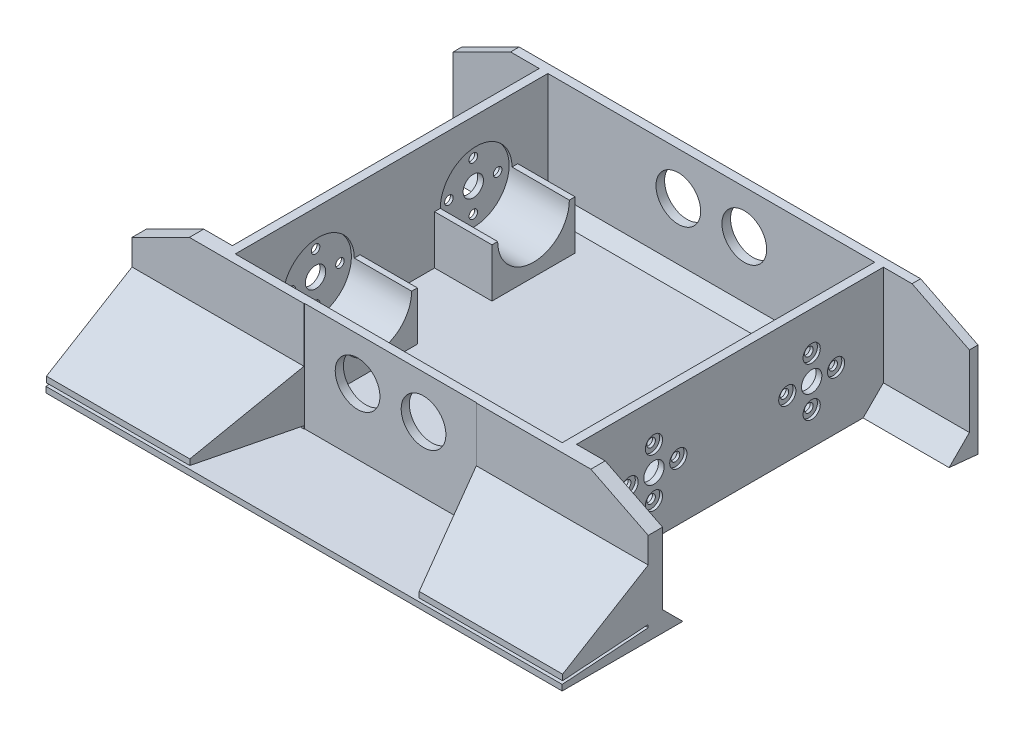
from build123d import *

# Parameters (mm, degrees)
SKETCH1_W                       = 180
SKETCH1_H                       = 145
BOSS_EXTRUDE1_DEPTH             = 2
BOSS_EXTRUDE2_DEPTH             = 180
SKETCH6_W                       = 180
SKETCH6_H                       = 115
BOSS_EXTRUDE3_DEPTH             = 40
SKETCH8_W                       = 30
SKETCH8_H                       = 110
CUT_EXTRUDE3_DEPTH              = 42
SHELL1_START                    = -69.5
SHELL1_OUTLINE_W                = 114
SHELL1_OUTLINE_H                = 39
SHELL1_DEPTH                    = 109
BOSS_EXTRUDE5_DEPTH             = 20
CUT_EXTRUDE11_REACH             = 171.202
SKETCH20_R                      = 3.55
SKETCH20_R_2                    = 1.5
CUT_EXTRUDE11_DIRECTION_2_REACH = 171.202
SKETCH21_R                      = 3
CUT_EXTRUDE12_DEPTH             = 1
CUT_EXTRUDE13_START             = -1
SKETCH22_R                      = 3
CUT_EXTRUDE13_DEPTH             = 1
CUT_EXTRUDE14_DEPTH             = 58
CUT_EXTRUDE14_DEPTH_BACK        = 58
SKETCH23_R                      = 12.5
BOSS_EXTRUDE7_DEPTH             = 180
CUT_EXTRUDE18_REACH             = 124.964
BOSS_EXTRUDE8_REACH             = 173.815
BOSS_EXTRUDE8_DIRECTION_2_REACH = 173.815
CUT_EXTRUDE19_REACH             = 153.951
CUT_EXTRUDE10_REACH             = 124.964
SKETCH16_R                      = 7.8
CUT_EXTRUDE10_DIRECTION_2_REACH = 124.964
BOSS_EXTRUDE9_REACH             = 200.545
CUT_EXTRUDE1_REACH              = 123.039
SKETCH4_R                       = 1.5
CUT_EXTRUDE1_DIRECTION_2_DEPTH  = 5


# Read off the part's stored shape, not the designer's step: Shell1
with BuildPart() as part:
    # Sketch1 → Boss-Extrude1 (new body)
    with BuildSketch(Plane(origin=(0, 0, 0), x_dir=(1, 0, 0), z_dir=(0, 1, 0))):
        Rectangle(SKETCH1_W, SKETCH1_H)
    extrude(amount=BOSS_EXTRUDE1_DEPTH)

    # Sketch3 → Boss-Extrude2 (add)
    with BuildSketch(Plane.ZY.offset(90)):
        Polygon((72.5, 0), (42.5, 0), (42.5, 4.097804358), (72.5, 2), align=None)
    extrude(amount=-BOSS_EXTRUDE2_DEPTH)

    # Sketch6 → Boss-Extrude3 (add)
    with BuildSketch(Plane(origin=(0, 2, 0), x_dir=(1, 0, 0), z_dir=(0, 1, 0))):
        with Locations((0, 15)):
            Rectangle(SKETCH6_W, SKETCH6_H)
    extrude(amount=BOSS_EXTRUDE3_DEPTH)

    # Sketch8 → Cut-Extrude3 (cut)
    with BuildSketch(Plane(origin=(0, 42, 0), x_dir=(1, 0, 0), z_dir=(0, 1, 0))):
        with Locations((-75, 17.5)):
            Rectangle(SKETCH8_W, SKETCH8_H)
        with Locations((75, 17.5)):
            Rectangle(SKETCH8_W, SKETCH8_H)
    extrude(amount=-CUT_EXTRUDE3_DEPTH, mode=Mode.SUBTRACT)

    # Shell1 outline → Shell1 (cut)
    with BuildSketch(Plane.XY.offset(SHELL1_START)):
        with Locations((0, 22.5)):
            Rectangle(SHELL1_OUTLINE_W, SHELL1_OUTLINE_H)
    extrude(amount=SHELL1_DEPTH, mode=Mode.SUBTRACT)

    # Sketch11 → Boss-Extrude5 (add)
    with BuildSketch(Plane(origin=(-57, 0, 0), x_dir=(0, 0, -1), z_dir=(1, 0, 0))):
        with BuildLine():
            Line((57, 20), (59, 20))
            Line((59, 20), (59, 0))
            Line((59, 0), (30, 0))
            Line((30, 0), (30, 20))
            Line((30, 20), (32, 20))
            ThreePointArc((32, 20), (44.5, 7.5), (57, 20))
        make_face()
        with BuildLine():
            Line((2, 20), (4, 20))
            Line((4, 20), (4, 0))
            Line((4, 0), (-25, 0))
            Line((-25, 0), (-25, 20))
            Line((-25, 20), (-23, 20))
            ThreePointArc((-23, 20), (-10.5, 7.5), (2, 20))
        make_face()
    boss_extrude5 = extrude(amount=BOSS_EXTRUDE5_DEPTH)

    # Mirror1: Boss-Extrude5 across plane
    add(boss_extrude5.mirror(Plane(origin=(0, 0, 0), x_dir=(0, 0, 1), z_dir=(1, 0, 0))))

    # Cut-Extrude11: up to this face of the body (flat: up to its plane)
    cut_extrude11_end = Plane(part.part.faces().sort_by_distance((60, 21, -17.5))[0])
    # Sketch20 → Cut-Extrude11 (cut, up to the picked face)
    with BuildSketch(Plane(origin=(-57, 0, 0), x_dir=(0, 0, -1), z_dir=(1, 0, 0)), mode=Mode.PRIVATE) as cut_extrude11_sk1:
        with Locations(Location((-10.5, 20, 0), (0, 0, 180))):
            Circle(SKETCH20_R)
    cut_extrude11_tool1 = split(extrude(cut_extrude11_sk1.sketch, amount=CUT_EXTRUDE11_REACH, mode=Mode.PRIVATE), bisect_by=cut_extrude11_end, keep=Keep.BOTH, mode=Mode.PRIVATE)
    # Sketch20 → Cut-Extrude11 (cut, up to the picked face)
    with BuildSketch(Plane(origin=(-57, 0, 0), x_dir=(0, 0, -1), z_dir=(1, 0, 0)), mode=Mode.PRIVATE) as cut_extrude11_sk2:
        with Locations(Location((44.5, 20, 0), (0, 0, 180))):
            Circle(SKETCH20_R)
    cut_extrude11_tool2 = split(extrude(cut_extrude11_sk2.sketch, amount=CUT_EXTRUDE11_REACH, mode=Mode.PRIVATE), bisect_by=cut_extrude11_end, keep=Keep.BOTH, mode=Mode.PRIVATE)
    # Sketch20 → Cut-Extrude11 (cut, up to the picked face)
    with BuildSketch(Plane(origin=(-57, 0, 0), x_dir=(0, 0, -1), z_dir=(1, 0, 0)), mode=Mode.PRIVATE) as cut_extrude11_sk3:
        with Locations(Location((-2, 20, 0), (0, 0, 180))):
            Circle(SKETCH20_R_2)
    cut_extrude11_tool3 = split(extrude(cut_extrude11_sk3.sketch, amount=CUT_EXTRUDE11_REACH, mode=Mode.PRIVATE), bisect_by=cut_extrude11_end, keep=Keep.BOTH, mode=Mode.PRIVATE)
    # Sketch20 → Cut-Extrude11 (cut, up to the picked face)
    with BuildSketch(Plane(origin=(-57, 0, 0), x_dir=(0, 0, -1), z_dir=(1, 0, 0)), mode=Mode.PRIVATE) as cut_extrude11_sk4:
        with Locations(Location((-19, 20, 0), (0, 0, 180))):
            Circle(SKETCH20_R_2)
    cut_extrude11_tool4 = split(extrude(cut_extrude11_sk4.sketch, amount=CUT_EXTRUDE11_REACH, mode=Mode.PRIVATE), bisect_by=cut_extrude11_end, keep=Keep.BOTH, mode=Mode.PRIVATE)
    # Sketch20 → Cut-Extrude11 (cut, up to the picked face)
    with BuildSketch(Plane(origin=(-57, 0, 0), x_dir=(0, 0, -1), z_dir=(1, 0, 0)), mode=Mode.PRIVATE) as cut_extrude11_sk5:
        with Locations(Location((-10.5, 28.5, 0), (0, 0, 180))):
            Circle(SKETCH20_R_2)
    cut_extrude11_tool5 = split(extrude(cut_extrude11_sk5.sketch, amount=CUT_EXTRUDE11_REACH, mode=Mode.PRIVATE), bisect_by=cut_extrude11_end, keep=Keep.BOTH, mode=Mode.PRIVATE)
    # Sketch20 → Cut-Extrude11 (cut, up to the picked face)
    with BuildSketch(Plane(origin=(-57, 0, 0), x_dir=(0, 0, -1), z_dir=(1, 0, 0)), mode=Mode.PRIVATE) as cut_extrude11_sk6:
        with Locations(Location((-10.5, 11.5, 0), (0, 0, 180))):
            Circle(SKETCH20_R_2)
    cut_extrude11_tool6 = split(extrude(cut_extrude11_sk6.sketch, amount=CUT_EXTRUDE11_REACH, mode=Mode.PRIVATE), bisect_by=cut_extrude11_end, keep=Keep.BOTH, mode=Mode.PRIVATE)
    # Sketch20 → Cut-Extrude11 (cut, up to the picked face)
    with BuildSketch(Plane(origin=(-57, 0, 0), x_dir=(0, 0, -1), z_dir=(1, 0, 0)), mode=Mode.PRIVATE) as cut_extrude11_sk7:
        with Locations(Location((36, 20, 0), (0, 0, 180))):
            Circle(SKETCH20_R_2)
    cut_extrude11_tool7 = split(extrude(cut_extrude11_sk7.sketch, amount=CUT_EXTRUDE11_REACH, mode=Mode.PRIVATE), bisect_by=cut_extrude11_end, keep=Keep.BOTH, mode=Mode.PRIVATE)
    # Sketch20 → Cut-Extrude11 (cut, up to the picked face)
    with BuildSketch(Plane(origin=(-57, 0, 0), x_dir=(0, 0, -1), z_dir=(1, 0, 0)), mode=Mode.PRIVATE) as cut_extrude11_sk8:
        with Locations(Location((53, 20, 0), (0, 0, 180))):
            Circle(SKETCH20_R_2)
    cut_extrude11_tool8 = split(extrude(cut_extrude11_sk8.sketch, amount=CUT_EXTRUDE11_REACH, mode=Mode.PRIVATE), bisect_by=cut_extrude11_end, keep=Keep.BOTH, mode=Mode.PRIVATE)
    # Sketch20 → Cut-Extrude11 (cut, up to the picked face)
    with BuildSketch(Plane(origin=(-57, 0, 0), x_dir=(0, 0, -1), z_dir=(1, 0, 0)), mode=Mode.PRIVATE) as cut_extrude11_sk9:
        with Locations(Location((44.5, 11.5, 0), (0, 0, 180))):
            Circle(SKETCH20_R_2)
    cut_extrude11_tool9 = split(extrude(cut_extrude11_sk9.sketch, amount=CUT_EXTRUDE11_REACH, mode=Mode.PRIVATE), bisect_by=cut_extrude11_end, keep=Keep.BOTH, mode=Mode.PRIVATE)
    # Sketch20 → Cut-Extrude11 (cut, up to the picked face)
    with BuildSketch(Plane(origin=(-57, 0, 0), x_dir=(0, 0, -1), z_dir=(1, 0, 0)), mode=Mode.PRIVATE) as cut_extrude11_sk10:
        with Locations(Location((44.5, 28.5, 0), (0, 0, 180))):
            Circle(SKETCH20_R_2)
    cut_extrude11_tool10 = split(extrude(cut_extrude11_sk10.sketch, amount=CUT_EXTRUDE11_REACH, mode=Mode.PRIVATE), bisect_by=cut_extrude11_end, keep=Keep.BOTH, mode=Mode.PRIVATE)
    add(cut_extrude11_tool1.solids().sort_by(Axis((-57, 20, 10.5), (1, 0, 0)))[0], mode=Mode.SUBTRACT)
    add(cut_extrude11_tool2.solids().sort_by(Axis((-57, 20, -44.5), (1, 0, 0)))[0], mode=Mode.SUBTRACT)
    add(cut_extrude11_tool3.solids().sort_by(Axis((-57, 20, 2), (1, 0, 0)))[0], mode=Mode.SUBTRACT)
    add(cut_extrude11_tool4.solids().sort_by(Axis((-57, 20, 19), (1, 0, 0)))[0], mode=Mode.SUBTRACT)
    add(cut_extrude11_tool5.solids().sort_by(Axis((-57, 28.5, 10.5), (1, 0, 0)))[0], mode=Mode.SUBTRACT)
    add(cut_extrude11_tool6.solids().sort_by(Axis((-57, 11.5, 10.5), (1, 0, 0)))[0], mode=Mode.SUBTRACT)
    add(cut_extrude11_tool7.solids().sort_by(Axis((-57, 20, -36), (1, 0, 0)))[0], mode=Mode.SUBTRACT)
    add(cut_extrude11_tool8.solids().sort_by(Axis((-57, 20, -53), (1, 0, 0)))[0], mode=Mode.SUBTRACT)
    add(cut_extrude11_tool9.solids().sort_by(Axis((-57, 11.5, -44.5), (1, 0, 0)))[0], mode=Mode.SUBTRACT)
    add(cut_extrude11_tool10.solids().sort_by(Axis((-57, 28.5, -44.5), (1, 0, 0)))[0], mode=Mode.SUBTRACT)

    # Cut-Extrude11 direction 2: up to this face of the body (flat: up to its plane)
    cut_extrude11_direction_2_end = Plane(part.part.faces().sort_by_distance((-60, 21, -17.5))[0])
    # Sketch20 → Cut-Extrude11 direction 2 (cut, up to the picked face)
    with BuildSketch(Plane(origin=(-57, 0, 0), x_dir=(0, 0, -1), z_dir=(1, 0, 0)), mode=Mode.PRIVATE) as cut_extrude11_direction_2_sk1:
        with Locations(Location((-10.5, 20, 0), (0, 0, 180))):
            Circle(SKETCH20_R)
    cut_extrude11_direction_2_tool1 = split(extrude(cut_extrude11_direction_2_sk1.sketch, amount=-CUT_EXTRUDE11_DIRECTION_2_REACH, mode=Mode.PRIVATE), bisect_by=cut_extrude11_direction_2_end, keep=Keep.BOTH, mode=Mode.PRIVATE)
    # Sketch20 → Cut-Extrude11 direction 2 (cut, up to the picked face)
    with BuildSketch(Plane(origin=(-57, 0, 0), x_dir=(0, 0, -1), z_dir=(1, 0, 0)), mode=Mode.PRIVATE) as cut_extrude11_direction_2_sk2:
        with Locations(Location((44.5, 20, 0), (0, 0, 180))):
            Circle(SKETCH20_R)
    cut_extrude11_direction_2_tool2 = split(extrude(cut_extrude11_direction_2_sk2.sketch, amount=-CUT_EXTRUDE11_DIRECTION_2_REACH, mode=Mode.PRIVATE), bisect_by=cut_extrude11_direction_2_end, keep=Keep.BOTH, mode=Mode.PRIVATE)
    # Sketch20 → Cut-Extrude11 direction 2 (cut, up to the picked face)
    with BuildSketch(Plane(origin=(-57, 0, 0), x_dir=(0, 0, -1), z_dir=(1, 0, 0)), mode=Mode.PRIVATE) as cut_extrude11_direction_2_sk3:
        with Locations(Location((-2, 20, 0), (0, 0, 180))):
            Circle(SKETCH20_R_2)
    cut_extrude11_direction_2_tool3 = split(extrude(cut_extrude11_direction_2_sk3.sketch, amount=-CUT_EXTRUDE11_DIRECTION_2_REACH, mode=Mode.PRIVATE), bisect_by=cut_extrude11_direction_2_end, keep=Keep.BOTH, mode=Mode.PRIVATE)
    # Sketch20 → Cut-Extrude11 direction 2 (cut, up to the picked face)
    with BuildSketch(Plane(origin=(-57, 0, 0), x_dir=(0, 0, -1), z_dir=(1, 0, 0)), mode=Mode.PRIVATE) as cut_extrude11_direction_2_sk4:
        with Locations(Location((-19, 20, 0), (0, 0, 180))):
            Circle(SKETCH20_R_2)
    cut_extrude11_direction_2_tool4 = split(extrude(cut_extrude11_direction_2_sk4.sketch, amount=-CUT_EXTRUDE11_DIRECTION_2_REACH, mode=Mode.PRIVATE), bisect_by=cut_extrude11_direction_2_end, keep=Keep.BOTH, mode=Mode.PRIVATE)
    # Sketch20 → Cut-Extrude11 direction 2 (cut, up to the picked face)
    with BuildSketch(Plane(origin=(-57, 0, 0), x_dir=(0, 0, -1), z_dir=(1, 0, 0)), mode=Mode.PRIVATE) as cut_extrude11_direction_2_sk5:
        with Locations(Location((-10.5, 28.5, 0), (0, 0, 180))):
            Circle(SKETCH20_R_2)
    cut_extrude11_direction_2_tool5 = split(extrude(cut_extrude11_direction_2_sk5.sketch, amount=-CUT_EXTRUDE11_DIRECTION_2_REACH, mode=Mode.PRIVATE), bisect_by=cut_extrude11_direction_2_end, keep=Keep.BOTH, mode=Mode.PRIVATE)
    # Sketch20 → Cut-Extrude11 direction 2 (cut, up to the picked face)
    with BuildSketch(Plane(origin=(-57, 0, 0), x_dir=(0, 0, -1), z_dir=(1, 0, 0)), mode=Mode.PRIVATE) as cut_extrude11_direction_2_sk6:
        with Locations(Location((-10.5, 11.5, 0), (0, 0, 180))):
            Circle(SKETCH20_R_2)
    cut_extrude11_direction_2_tool6 = split(extrude(cut_extrude11_direction_2_sk6.sketch, amount=-CUT_EXTRUDE11_DIRECTION_2_REACH, mode=Mode.PRIVATE), bisect_by=cut_extrude11_direction_2_end, keep=Keep.BOTH, mode=Mode.PRIVATE)
    # Sketch20 → Cut-Extrude11 direction 2 (cut, up to the picked face)
    with BuildSketch(Plane(origin=(-57, 0, 0), x_dir=(0, 0, -1), z_dir=(1, 0, 0)), mode=Mode.PRIVATE) as cut_extrude11_direction_2_sk7:
        with Locations(Location((36, 20, 0), (0, 0, 180))):
            Circle(SKETCH20_R_2)
    cut_extrude11_direction_2_tool7 = split(extrude(cut_extrude11_direction_2_sk7.sketch, amount=-CUT_EXTRUDE11_DIRECTION_2_REACH, mode=Mode.PRIVATE), bisect_by=cut_extrude11_direction_2_end, keep=Keep.BOTH, mode=Mode.PRIVATE)
    # Sketch20 → Cut-Extrude11 direction 2 (cut, up to the picked face)
    with BuildSketch(Plane(origin=(-57, 0, 0), x_dir=(0, 0, -1), z_dir=(1, 0, 0)), mode=Mode.PRIVATE) as cut_extrude11_direction_2_sk8:
        with Locations(Location((53, 20, 0), (0, 0, 180))):
            Circle(SKETCH20_R_2)
    cut_extrude11_direction_2_tool8 = split(extrude(cut_extrude11_direction_2_sk8.sketch, amount=-CUT_EXTRUDE11_DIRECTION_2_REACH, mode=Mode.PRIVATE), bisect_by=cut_extrude11_direction_2_end, keep=Keep.BOTH, mode=Mode.PRIVATE)
    # Sketch20 → Cut-Extrude11 direction 2 (cut, up to the picked face)
    with BuildSketch(Plane(origin=(-57, 0, 0), x_dir=(0, 0, -1), z_dir=(1, 0, 0)), mode=Mode.PRIVATE) as cut_extrude11_direction_2_sk9:
        with Locations(Location((44.5, 11.5, 0), (0, 0, 180))):
            Circle(SKETCH20_R_2)
    cut_extrude11_direction_2_tool9 = split(extrude(cut_extrude11_direction_2_sk9.sketch, amount=-CUT_EXTRUDE11_DIRECTION_2_REACH, mode=Mode.PRIVATE), bisect_by=cut_extrude11_direction_2_end, keep=Keep.BOTH, mode=Mode.PRIVATE)
    # Sketch20 → Cut-Extrude11 direction 2 (cut, up to the picked face)
    with BuildSketch(Plane(origin=(-57, 0, 0), x_dir=(0, 0, -1), z_dir=(1, 0, 0)), mode=Mode.PRIVATE) as cut_extrude11_direction_2_sk10:
        with Locations(Location((44.5, 28.5, 0), (0, 0, 180))):
            Circle(SKETCH20_R_2)
    cut_extrude11_direction_2_tool10 = split(extrude(cut_extrude11_direction_2_sk10.sketch, amount=-CUT_EXTRUDE11_DIRECTION_2_REACH, mode=Mode.PRIVATE), bisect_by=cut_extrude11_direction_2_end, keep=Keep.BOTH, mode=Mode.PRIVATE)
    add(cut_extrude11_direction_2_tool1.solids().sort_by(Axis((-57, 20, 10.5), (-1, 0, 0)))[0], mode=Mode.SUBTRACT)
    add(cut_extrude11_direction_2_tool2.solids().sort_by(Axis((-57, 20, -44.5), (-1, 0, 0)))[0], mode=Mode.SUBTRACT)
    add(cut_extrude11_direction_2_tool3.solids().sort_by(Axis((-57, 20, 2), (-1, 0, 0)))[0], mode=Mode.SUBTRACT)
    add(cut_extrude11_direction_2_tool4.solids().sort_by(Axis((-57, 20, 19), (-1, 0, 0)))[0], mode=Mode.SUBTRACT)
    add(cut_extrude11_direction_2_tool5.solids().sort_by(Axis((-57, 28.5, 10.5), (-1, 0, 0)))[0], mode=Mode.SUBTRACT)
    add(cut_extrude11_direction_2_tool6.solids().sort_by(Axis((-57, 11.5, 10.5), (-1, 0, 0)))[0], mode=Mode.SUBTRACT)
    add(cut_extrude11_direction_2_tool7.solids().sort_by(Axis((-57, 20, -36), (-1, 0, 0)))[0], mode=Mode.SUBTRACT)
    add(cut_extrude11_direction_2_tool8.solids().sort_by(Axis((-57, 20, -53), (-1, 0, 0)))[0], mode=Mode.SUBTRACT)
    add(cut_extrude11_direction_2_tool9.solids().sort_by(Axis((-57, 11.5, -44.5), (-1, 0, 0)))[0], mode=Mode.SUBTRACT)
    add(cut_extrude11_direction_2_tool10.solids().sort_by(Axis((-57, 28.5, -44.5), (-1, 0, 0)))[0], mode=Mode.SUBTRACT)

    # Sketch21 → Cut-Extrude12 (cut)
    with BuildSketch(Plane(origin=(60, 0, 0), x_dir=(0, 0, -1), z_dir=(1, 0, 0))):
        with Locations((-10.5, 28.5)):
            Circle(SKETCH21_R)
        with Locations((-2, 20)):
            Circle(SKETCH21_R)
        with Locations((-19, 20)):
            Circle(SKETCH21_R)
        with Locations((-10.5, 11.5)):
            Circle(SKETCH21_R)
        with Locations((44.5, 28.5)):
            Circle(SKETCH21_R)
        with Locations((53, 20)):
            Circle(SKETCH21_R)
        with Locations((44.5, 11.5)):
            Circle(SKETCH21_R)
        with Locations((36, 20)):
            Circle(SKETCH21_R)
    extrude(amount=-CUT_EXTRUDE12_DEPTH, mode=Mode.SUBTRACT)

    # Sketch22 → Cut-Extrude13 (cut)
    with BuildSketch(Plane.ZY.offset(60).offset(CUT_EXTRUDE13_START)):
        with Locations(Location((-44.5, 28.5, 0), (0, 0, 180))):
            Circle(SKETCH22_R)
        with Locations(Location((-36, 20, 0), (0, 0, 180))):
            Circle(SKETCH22_R)
        with Locations(Location((-44.5, 11.5, 0), (0, 0, 180))):
            Circle(SKETCH22_R)
        with Locations(Location((-53, 20, 0), (0, 0, 180))):
            Circle(SKETCH22_R)
        with Locations(Location((2, 20, 0), (0, 0, 180))):
            Circle(SKETCH22_R)
        with Locations(Location((10.5, 28.5, 0), (0, 0, 180))):
            Circle(SKETCH22_R)
        with Locations(Location((10.5, 11.5, 0), (0, 0, 180))):
            Circle(SKETCH22_R)
        with Locations(Location((19, 20, 0), (0, 0, 180))):
            Circle(SKETCH22_R)
    extrude(amount=CUT_EXTRUDE13_DEPTH, mode=Mode.SUBTRACT)

    # Sketch23 → Cut-Extrude14 (cut, two sides: drawn at the far end of the back side and taken through both)
    with BuildSketch(Plane(origin=(0, 0, 0), x_dir=(0, 0, -1), z_dir=(1, 0, 0)).offset(-CUT_EXTRUDE14_DEPTH_BACK)):
        with Locations((44.5, 20)):
            Circle(SKETCH23_R)
        with Locations((-10.5, 20)):
            Circle(SKETCH23_R)
    extrude(amount=CUT_EXTRUDE14_DEPTH + CUT_EXTRUDE14_DEPTH_BACK, mode=Mode.SUBTRACT)

    # Sketch24 → Boss-Extrude7 (add)
    with BuildSketch(Plane.ZY.offset(90)):
        Polygon((72.349652408, 3.012955226), (42.5, 5.100246256), (42.5, 23.048902179), (72.349652408, 5.012955226), align=None)
    extrude(amount=-BOSS_EXTRUDE7_DEPTH)

    # Cut-Extrude18: up to this plane
    cut_extrude18_end = Plane(origin=(120.278573291, 4.097804358, 42.5), z_dir=(0, 0.9975640502598243, 0.0697564737441255))
    # Sketch25 → Cut-Extrude18 (cut, up to the surface)
    with BuildSketch(Plane(origin=(0, 42, 0), x_dir=(1, 0, 0), z_dir=(0, 1, 0)), mode=Mode.PRIVATE) as cut_extrude18_sk1:
        Polygon((-30, -42.349652408), (30, -42.349652408), (40, -72.349652408), (-40, -72.349652408), align=None)
    cut_extrude18_tool1 = split(extrude(cut_extrude18_sk1.sketch, amount=-CUT_EXTRUDE18_REACH, mode=Mode.PRIVATE), bisect_by=cut_extrude18_end, keep=Keep.BOTH, mode=Mode.PRIVATE)
    add(cut_extrude18_tool1.solids().sort_by_distance((0, 42, 58.063938))[0], mode=Mode.SUBTRACT)

    # Boss-Extrude8: up to this face of the body (flat: up to its plane)
    boss_extrude8_end = Plane(part.part.faces().sort_by_distance((-90, 12.761577893, 49.090571311))[0])
    # Sketch26 → Boss-Extrude8 (add, up to the picked face)
    with BuildSketch(Plane.ZY.offset(60), mode=Mode.PRIVATE) as boss_extrude8_sk1:
        Polygon((-72.5, 0), (-72.5, 42), (-69.5, 42), (-69.5, 7.071067812), (-62.428932188, 0), (-72.5, -1), align=None)
    boss_extrude8_tool1 = split(extrude(boss_extrude8_sk1.sketch, amount=BOSS_EXTRUDE8_REACH, mode=Mode.PRIVATE), bisect_by=boss_extrude8_end, keep=Keep.BOTH, mode=Mode.PRIVATE)
    add(boss_extrude8_tool1.solids().sort_by(Axis((-60, 17.324561, -70.322099), (-1, 0, 0)))[0])

    # Boss-Extrude8 direction 2: up to this face of the body (flat: up to its plane)
    boss_extrude8_direction_2_end = Plane(part.part.faces().sort_by_distance((90, 12.761577893, 49.090571311))[0])
    # Sketch26 → Boss-Extrude8 direction 2 (add, up to the picked face)
    with BuildSketch(Plane.ZY.offset(60), mode=Mode.PRIVATE) as boss_extrude8_direction_2_sk1:
        Polygon((-72.5, 0), (-72.5, 42), (-69.5, 42), (-69.5, 7.071067812), (-62.428932188, 0), (-72.5, -1), align=None)
    boss_extrude8_direction_2_tool1 = split(extrude(boss_extrude8_direction_2_sk1.sketch, amount=-BOSS_EXTRUDE8_DIRECTION_2_REACH, mode=Mode.PRIVATE), bisect_by=boss_extrude8_direction_2_end, keep=Keep.BOTH, mode=Mode.PRIVATE)
    add(boss_extrude8_direction_2_tool1.solids().sort_by(Axis((-60, 17.324561, -70.322099), (1, 0, 0)))[0])

    # Cut-Extrude19: up to this face of the body (flat: up to its plane)
    cut_extrude19_end = Plane(part.part.faces().sort_by_distance((0, 20.5, -72.5))[0])
    # Sketch27 → Cut-Extrude19 (cut, up to the picked face)
    with BuildSketch(Plane.XY.offset(42.5), mode=Mode.PRIVATE) as cut_extrude19_sk1:
        Polygon((-90, 42), (-90, 32), (-70, 42), align=None)
    cut_extrude19_tool1 = split(extrude(cut_extrude19_sk1.sketch, amount=-CUT_EXTRUDE19_REACH, mode=Mode.PRIVATE), bisect_by=cut_extrude19_end, keep=Keep.BOTH, mode=Mode.PRIVATE)
    # Sketch27 → Cut-Extrude19 (cut, up to the picked face)
    with BuildSketch(Plane.XY.offset(42.5), mode=Mode.PRIVATE) as cut_extrude19_sk2:
        Polygon((90, 42), (90, 32), (70, 42), align=None)
    cut_extrude19_tool2 = split(extrude(cut_extrude19_sk2.sketch, amount=-CUT_EXTRUDE19_REACH, mode=Mode.PRIVATE), bisect_by=cut_extrude19_end, keep=Keep.BOTH, mode=Mode.PRIVATE)
    add(cut_extrude19_tool1.solids().sort_by(Axis((-83.333333, 38.666667, 42.5), (0, 0, -1)))[0], mode=Mode.SUBTRACT)
    add(cut_extrude19_tool2.solids().sort_by(Axis((83.333333, 38.666667, 42.5), (0, 0, -1)))[0], mode=Mode.SUBTRACT)

    # Cut-Extrude10: up to this face of the body (flat: up to its plane)
    cut_extrude10_end = Plane(part.part.faces().sort_by_distance((0, 20.018125553, -72.5))[0])
    # Sketch16 → Cut-Extrude10 (cut, up to the picked face)
    with BuildSketch(Plane.XY, mode=Mode.PRIVATE) as cut_extrude10_sk1:
        with Locations(Location((-11.5, 27, 0), (0, 0, 180))):
            Circle(SKETCH16_R)
    cut_extrude10_tool1 = split(extrude(cut_extrude10_sk1.sketch, amount=-CUT_EXTRUDE10_REACH, mode=Mode.PRIVATE), bisect_by=cut_extrude10_end, keep=Keep.BOTH, mode=Mode.PRIVATE)
    # Sketch16 → Cut-Extrude10 (cut, up to the picked face)
    with BuildSketch(Plane.XY, mode=Mode.PRIVATE) as cut_extrude10_sk2:
        with Locations(Location((11.5, 27, 0), (0, 0, 180))):
            Circle(SKETCH16_R)
    cut_extrude10_tool2 = split(extrude(cut_extrude10_sk2.sketch, amount=-CUT_EXTRUDE10_REACH, mode=Mode.PRIVATE), bisect_by=cut_extrude10_end, keep=Keep.BOTH, mode=Mode.PRIVATE)
    add(cut_extrude10_tool1.solids().sort_by(Axis((-11.5, 27, 0), (0, 0, -1)))[0], mode=Mode.SUBTRACT)
    add(cut_extrude10_tool2.solids().sort_by(Axis((11.5, 27, 0), (0, 0, -1)))[0], mode=Mode.SUBTRACT)

    # Cut-Extrude10 direction 2: up to this face of the body (flat: up to its plane)
    cut_extrude10_direction_2_end = Plane(part.part.faces().sort_by_distance((57.77547654, 31.931639583, 42.5))[0])
    # Sketch16 → Cut-Extrude10 direction 2 (cut, up to the picked face)
    with BuildSketch(Plane.XY, mode=Mode.PRIVATE) as cut_extrude10_direction_2_sk1:
        with Locations(Location((-11.5, 27, 0), (0, 0, 180))):
            Circle(SKETCH16_R)
    cut_extrude10_direction_2_tool1 = split(extrude(cut_extrude10_direction_2_sk1.sketch, amount=CUT_EXTRUDE10_DIRECTION_2_REACH, mode=Mode.PRIVATE), bisect_by=cut_extrude10_direction_2_end, keep=Keep.BOTH, mode=Mode.PRIVATE)
    # Sketch16 → Cut-Extrude10 direction 2 (cut, up to the picked face)
    with BuildSketch(Plane.XY, mode=Mode.PRIVATE) as cut_extrude10_direction_2_sk2:
        with Locations(Location((11.5, 27, 0), (0, 0, 180))):
            Circle(SKETCH16_R)
    cut_extrude10_direction_2_tool2 = split(extrude(cut_extrude10_direction_2_sk2.sketch, amount=CUT_EXTRUDE10_DIRECTION_2_REACH, mode=Mode.PRIVATE), bisect_by=cut_extrude10_direction_2_end, keep=Keep.BOTH, mode=Mode.PRIVATE)
    add(cut_extrude10_direction_2_tool1.solids().sort_by(Axis((-11.5, 27, 0), (0, 0, 1)))[0], mode=Mode.SUBTRACT)
    add(cut_extrude10_direction_2_tool2.solids().sort_by(Axis((11.5, 27, 0), (0, 0, 1)))[0], mode=Mode.SUBTRACT)

    # Boss-Extrude9: up to this face of the body (flat: up to its plane)
    boss_extrude9_end = Plane(part.part.faces().sort_by_distance((-90, 10.554864328, 49.918194781))[0])
    # Sketch28 → Boss-Extrude9 (add, up to the picked face)
    with BuildSketch(Plane(origin=(90, 0, 0), x_dir=(0, 0, -1), z_dir=(1, 0, 0)), mode=Mode.PRIVATE) as boss_extrude9_sk1:
        Polygon((-37.5, 0), (-37.5, 7.071067812), (-30.428932188, 0), align=None)
    boss_extrude9_tool1 = split(extrude(boss_extrude9_sk1.sketch, amount=-BOSS_EXTRUDE9_REACH, mode=Mode.PRIVATE), bisect_by=boss_extrude9_end, keep=Keep.BOTH, mode=Mode.PRIVATE)
    add(boss_extrude9_tool1.solids().sort_by(Axis((90, 2.357023, 35.142977), (-1, 0, 0)))[0])

    # Cut-Extrude1: up to this plane
    cut_extrude1_end = Plane(origin=(0, 0, 0), z_dir=(0, -1, 0))
    # Sketch4 → Cut-Extrude1 (cut, up to the surface)
    with BuildSketch(Plane(origin=(0, 7.035292979, 0.491955609), x_dir=(1, 0, 0), z_dir=(0, 0.9975640502598242, 0.06975647374412548)), mode=Mode.PRIVATE) as cut_extrude1_sk1:
        with Locations(Location((-76.5, -49.183880696, 0), (0, 0, 90))):
            Circle(SKETCH4_R)
    cut_extrude1_tool1 = split(extrude(cut_extrude1_sk1.sketch, amount=-CUT_EXTRUDE1_REACH, mode=Mode.PRIVATE), bisect_by=cut_extrude1_end, keep=Keep.BOTH, mode=Mode.PRIVATE)
    add(cut_extrude1_tool1.solids().sort_by_distance((-76.5, 3.604399, 49.556027))[0], mode=Mode.SUBTRACT)
    # Sketch4 → Cut-Extrude1 (cut, up to the surface)
    with BuildSketch(Plane(origin=(0, 7.035292979, 0.491955609), x_dir=(1, 0, 0), z_dir=(0, 0.9975640502598242, 0.06975647374412548)), mode=Mode.PRIVATE) as cut_extrude1_sk2:
        with Locations(Location((-76.5, -66.183880696, 0), (0, 0, 90))):
            Circle(SKETCH4_R)
    cut_extrude1_tool2 = split(extrude(cut_extrude1_sk2.sketch, amount=-CUT_EXTRUDE1_REACH, mode=Mode.PRIVATE), bisect_by=cut_extrude1_end, keep=Keep.BOTH, mode=Mode.PRIVATE)
    add(cut_extrude1_tool2.solids().sort_by_distance((-76.5, 2.418539, 66.514616))[0], mode=Mode.SUBTRACT)
    # Sketch4 → Cut-Extrude1 (cut, up to the surface)
    with BuildSketch(Plane(origin=(0, 7.035292979, 0.491955609), x_dir=(1, 0, 0), z_dir=(0, 0.9975640502598242, 0.06975647374412548)), mode=Mode.PRIVATE) as cut_extrude1_sk3:
        with Locations(Location((76.5, -49.183880696, 0), (0, 0, 270))):
            Circle(SKETCH4_R)
    cut_extrude1_tool3 = split(extrude(cut_extrude1_sk3.sketch, amount=-CUT_EXTRUDE1_REACH, mode=Mode.PRIVATE), bisect_by=cut_extrude1_end, keep=Keep.BOTH, mode=Mode.PRIVATE)
    add(cut_extrude1_tool3.solids().sort_by_distance((76.5, 3.604399, 49.556027))[0], mode=Mode.SUBTRACT)
    # Sketch4 → Cut-Extrude1 (cut, up to the surface)
    with BuildSketch(Plane(origin=(0, 7.035292979, 0.491955609), x_dir=(1, 0, 0), z_dir=(0, 0.9975640502598242, 0.06975647374412548)), mode=Mode.PRIVATE) as cut_extrude1_sk4:
        with Locations(Location((76.5, -66.183880696, 0), (0, 0, 270))):
            Circle(SKETCH4_R)
    cut_extrude1_tool4 = split(extrude(cut_extrude1_sk4.sketch, amount=-CUT_EXTRUDE1_REACH, mode=Mode.PRIVATE), bisect_by=cut_extrude1_end, keep=Keep.BOTH, mode=Mode.PRIVATE)
    add(cut_extrude1_tool4.solids().sort_by_distance((76.5, 2.418539, 66.514616))[0], mode=Mode.SUBTRACT)

    # Sketch4 → Cut-Extrude1 direction 2 (cut)
    with BuildSketch(Plane(origin=(0, 7.035292979, 0.491955609), x_dir=(1, 0, 0), z_dir=(0, 0.9975640502598242, 0.06975647374412548))):
        with Locations(Location((-76.5, -49.183880696, 0), (0, 0, 90))):
            Circle(SKETCH4_R)
        with Locations(Location((-76.5, -66.183880696, 0), (0, 0, 90))):
            Circle(SKETCH4_R)
        with Locations(Location((76.5, -49.183880696, 0), (0, 0, 270))):
            Circle(SKETCH4_R)
        with Locations(Location((76.5, -66.183880696, 0), (0, 0, 270))):
            Circle(SKETCH4_R)
    extrude(amount=CUT_EXTRUDE1_DIRECTION_2_DEPTH, mode=Mode.SUBTRACT)


solid = part.part
